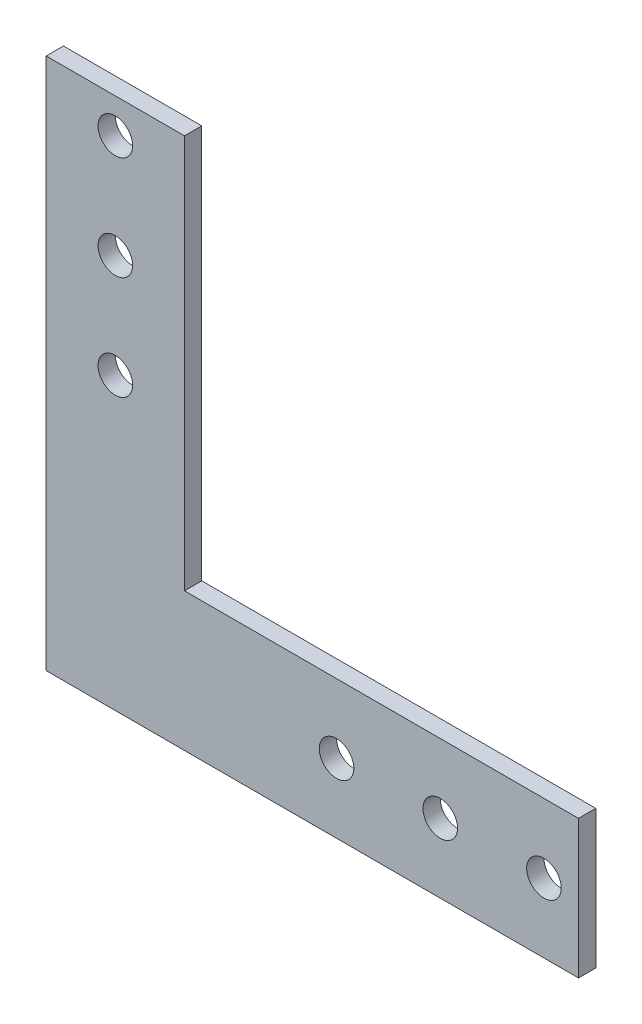
from build123d import *

# Parameters (mm, degrees)
BOSS_EXTRUDE1_DEPTH = 3.175
SKETCH2_R           = 3.175
CUT_EXTRUDE1_DEPTH  = 139.332385308


with BuildPart() as part:
    # Sketch1 → Boss-Extrude1 (new body)
    with BuildSketch(Plane.XY):
        Polygon((0, 25.4), (0, 0), (25.4, 0), (97.79, 0), (97.79, 25.4), (79.829487758, 25.4), (25.4, 25.4), (25.4, 79.829487758), (25.4, 97.79), (0, 97.79), align=None)
    extrude(amount=BOSS_EXTRUDE1_DEPTH)

    # Sketch2 → Cut-Extrude1 (cut, through all)
    with BuildSketch(Plane.XY.offset(3.175)):
        with Locations((53.34, 12.7)):
            Circle(SKETCH2_R)
        with Locations((72.39, 12.7)):
            Circle(SKETCH2_R)
        with Locations((12.7, 53.34)):
            Circle(SKETCH2_R)
        with Locations((12.7, 72.39)):
            Circle(SKETCH2_R)
        with Locations((12.7, 91.44)):
            Circle(SKETCH2_R)
        with Locations((91.44, 12.7)):
            Circle(SKETCH2_R)
    extrude(amount=-CUT_EXTRUDE1_DEPTH, mode=Mode.SUBTRACT)


solid = part.part
